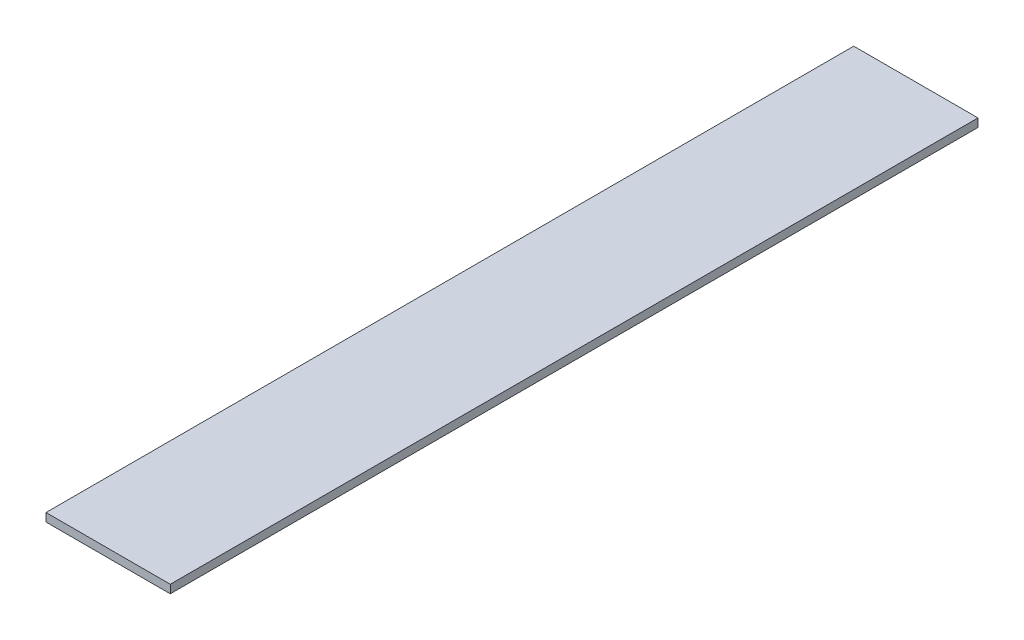
from build123d import *

# Parameters (mm, degrees)
SKETCH2_W           = 60
SKETCH2_H           = 390
BOSS_EXTRUDE1_DEPTH = 4


with BuildPart() as part:
    # Sketch2 → Boss-Extrude1 (new body)
    with BuildSketch(Plane(origin=(0, 0, 0), x_dir=(1, 0, 0), z_dir=(0, 1, 0))):
        with Locations((-95.454545455, 154.772727273)):
            Rectangle(SKETCH2_W, SKETCH2_H)
    extrude(amount=BOSS_EXTRUDE1_DEPTH)


solid = part.part
